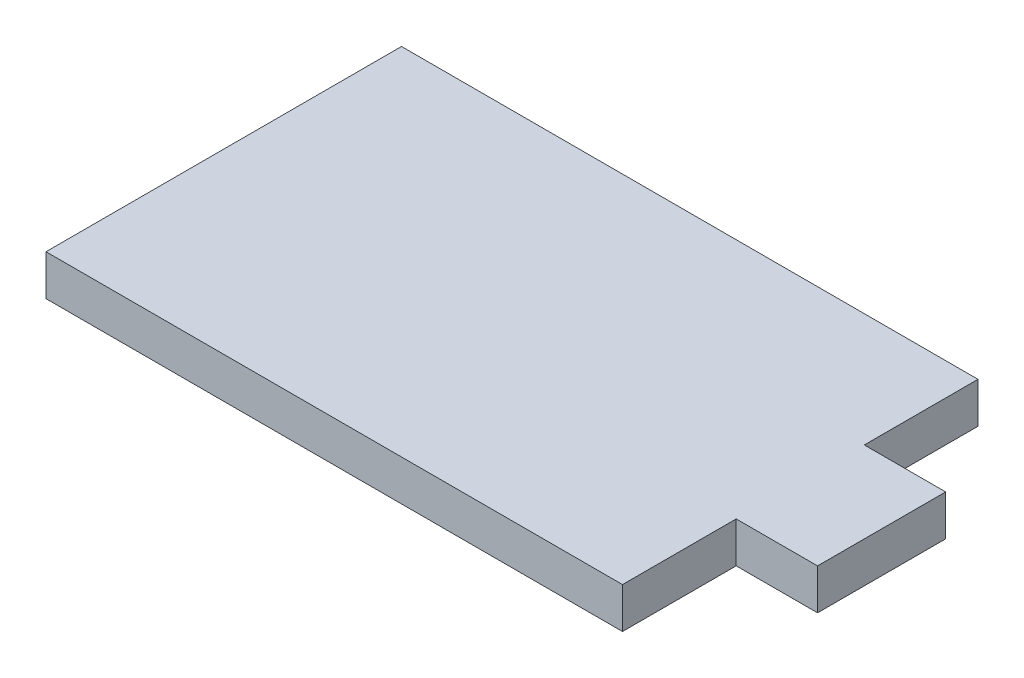
from build123d import *

# Parameters (mm, degrees)
BOSS_EXTRUDE1_DEPTH = 3.175


with BuildPart() as part:
    # Sketch1 → Boss-Extrude1 (new body)
    with BuildSketch(Plane(origin=(0, 0, 0), x_dir=(1, 0, 0), z_dir=(0, 1, 0))):
        Polygon((22.5, 8.875), (-22.5, 8.875), (-22.5, 0), (-22.5, -10), (-22.5, -18.875), (22.5, -18.875), (22.5, -10), (28.85, -10), (28.85, 0), (22.5, 0), align=None)
    extrude(amount=BOSS_EXTRUDE1_DEPTH)


solid = part.part
